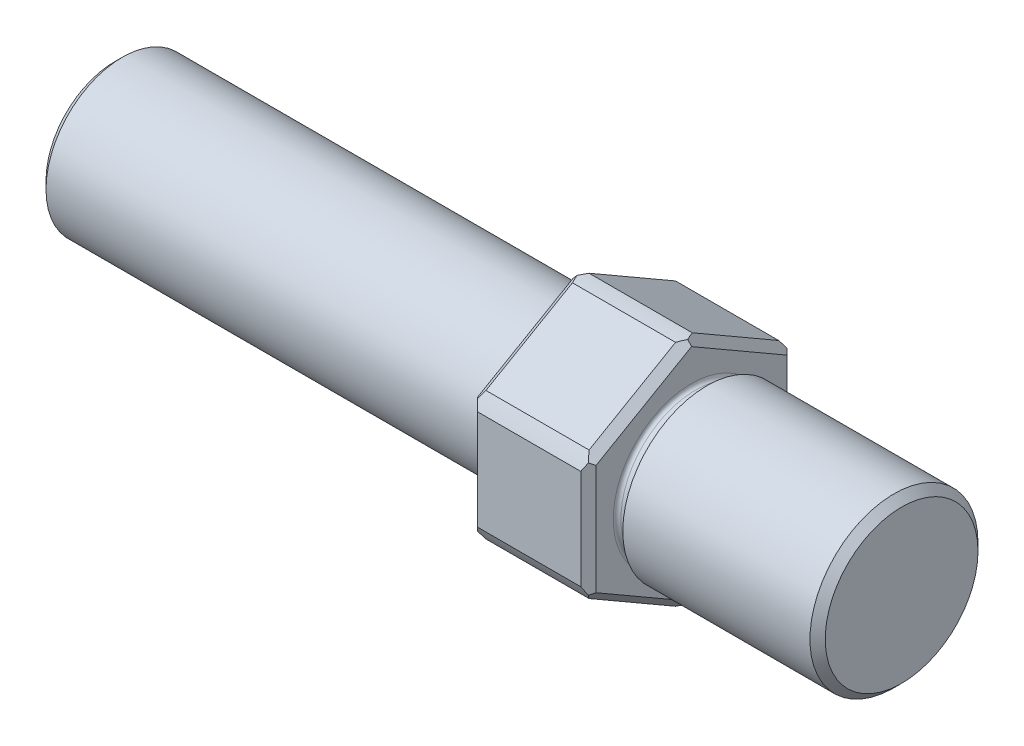
from build123d import *

# Parameters (mm, degrees)
CHAFL_N1_SIZE           = 1
REDONDEO1_R             = 1
CROQUIS2_R              = 21.776851014
CORTAR_EXTRUIR1_DEPTH   = 11
CHAFL_N2_SIZE           = 1
SALIENTE_EXTRUIR1_DEPTH = 15.5
CROQUIS12_W             = 2
CROQUIS12_H             = 2
REDONDEO3_R             = 0.5
SALIENTE_EXTRUIR3_START = 10
CROQUIS15_R             = 10
SALIENTE_EXTRUIR3_DEPTH = 10
CHAFL_N6_SIZE           = 1
CHAFL_N8_SIZE           = 1
CORTAR_EXTRUIR3_START   = -15.009619
CROQUIS17_R             = 19.700918629
CROQUIS17_R_2           = 15
CORTAR_EXTRUIR3_DEPTH   = 14.519238


with BuildPart() as part:
    # Croquis1 → Revolución1 (revolve)
    with BuildSketch(Plane(origin=(0, 0, 0), x_dir=(1, 0, 0), z_dir=(0, 1, 0))):
        Polygon((0, 0), (0, 11), (-50, 11), (-54, 11), (-54, 10), (-104, 10), (-104, 0), align=None)
    revolve(axis=Axis((0, 0, 0), (-1, 0, 0)))

    # Chaflán1
    chafl_n1_edges = [part.edges().sort_by_distance(p)[0] for p in [
        (0, 0, 11),
    ]]
    chamfer(chafl_n1_edges, length=CHAFL_N1_SIZE)

    # Redondeo1
    redondeo1_edges = [part.edges().sort_by_distance(p)[0] for p in [
        (-54, 0, 10),
    ]]
    fillet(redondeo1_edges, radius=REDONDEO1_R - 0.0001)  # a hair under: the kernel refuses the full size

    # Croquis2 → Cortar-Extruir1 (cut)
    with BuildSketch(Plane(origin=(0, 0, 0), x_dir=(0, 0, -1), z_dir=(1, 0, 0))):
        Circle(CROQUIS2_R)
    extrude(amount=-CORTAR_EXTRUIR1_DEPTH, mode=Mode.SUBTRACT)

    # Chaflán2
    chafl_n2_edges = [part.edges().sort_by_distance(p)[0] for p in [
        (-11, 0, 11),
    ]]
    chamfer(chafl_n2_edges, length=CHAFL_N2_SIZE)

    # Croquis10 → Saliente-Extruir1 (add)
    with BuildSketch(Plane(origin=(-54, 0, 0), x_dir=(0, 0, -1), z_dir=(1, 0, 0))):
        Polygon((-13.5, 7.794228634), (-13.5, -7.794228634), (0, -15.588457268), (13.5, -7.794228634), (13.5, 7.794228634), (0, 15.588457268), align=None)
    extrude(amount=SALIENTE_EXTRUIR1_DEPTH)

    # Croquis12 → Cortar-Revolución1 (revolve, cut)
    with BuildSketch(Plane(origin=(0, 0, 0), x_dir=(1, 0, 0), z_dir=(0, 1, 0)), mode=Mode.PRIVATE) as cortar_revoluci_n1_sk:
        with Locations((-37.5, -10.75)):
            Rectangle(CROQUIS12_W, CROQUIS12_H)
    revolve(cortar_revoluci_n1_sk.sketch.rotate(Axis((0, 0, 0), (-1, 0, 0)), 180), axis=Axis((0, 0, 0), (-1, 0, 0)), mode=Mode.SUBTRACT)

    # Redondeo3
    redondeo3_edges = [part.edges().sort_by_distance(p)[0] for p in [
        (-38.5, 0, 9.75),
    ]]
    fillet(redondeo3_edges, radius=REDONDEO3_R)

    # Croquis15 → Saliente-Extruir3 (add)
    with BuildSketch(Plane.ZY.offset(104).offset(SALIENTE_EXTRUIR3_START)):
        Circle(CROQUIS15_R)
    extrude(amount=-SALIENTE_EXTRUIR3_DEPTH)

    # Chaflán6
    chafl_n6_edges = [part.edges().sort_by_distance(p)[0] for p in [
        (-114, 0, -10),
    ]]
    chamfer(chafl_n6_edges, length=CHAFL_N6_SIZE)

    # Chaflán8
    chafl_n8_edges = [part.edges().sort_by_distance(p)[0] for p in [
        (-54, 11.691342951, 6.75),
        (-54, 0, 13.5),
        (-54, -11.691342951, 6.75),
        (-54, -11.691342951, -6.75),
        (-54, 0, -13.5),
        (-54, 11.691342951, -6.75),
        (-38.5, 11.691342951, 6.75),
        (-38.5, 0, 13.5),
        (-38.5, -11.691342951, 6.75),
        (-38.5, -11.691342951, -6.75),
        (-38.5, 0, -13.5),
        (-38.5, 11.691342951, -6.75),
    ]]
    chamfer(chafl_n8_edges, length=CHAFL_N8_SIZE)

    # Croquis17 → Cortar-Extruir3 (cut)
    with BuildSketch(Plane.ZY.offset(54).offset(CORTAR_EXTRUIR3_START)):
        Circle(CROQUIS17_R)
        Circle(CROQUIS17_R_2, mode=Mode.SUBTRACT)
    extrude(amount=CORTAR_EXTRUIR3_DEPTH, mode=Mode.SUBTRACT)


solid = part.part
